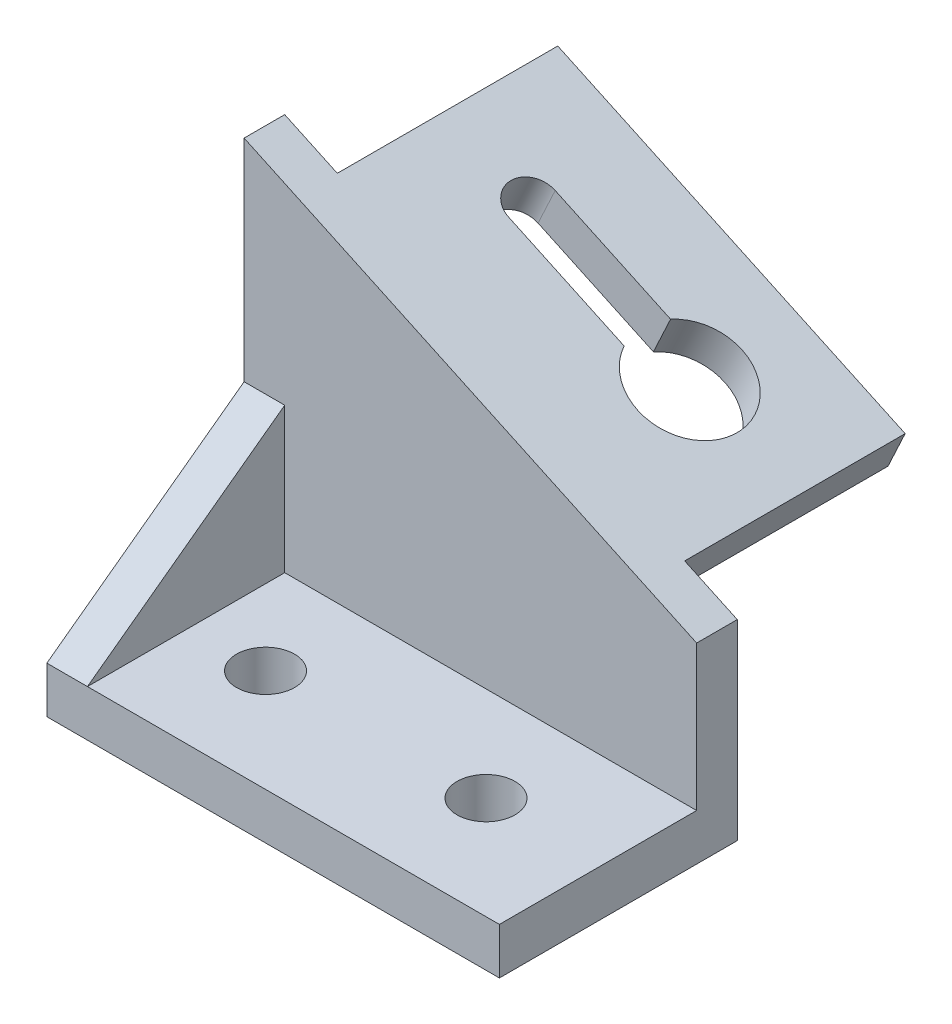
from build123d import *

# Parameters (mm, degrees)
SKETCH1_W           = 71
SKETCH1_H           = 34
SKETCH1_R           = 5
BOSS_EXTRUDE1_DEPTH = 8
SKETCH1_3_W         = 7
SKETCH1_3_H         = 34
BOSS_EXTRUDE2_DEPTH = 33
BOSS_EXTRUDE3_DEPTH = 80
CUT_EXTRUDE1_DEPTH  = 80
BOSS_EXTRUDE4_DEPTH = 7
CHAMFER1_SIZE2      = 34
CHAMFER1_SIZE       = 25


with BuildPart() as part:
    # Sketch1 → Boss-Extrude1 (new body)
    with BuildSketch(Plane(origin=(0, 0, 0), x_dir=(1, 0, 0), z_dir=(0, 1, 0))):
        with Locations((42.5, 17)):
            Rectangle(SKETCH1_W, SKETCH1_H)
        with Locations(Location((20, 17.695066584, 0), (0, 0, 270))):
            Circle(SKETCH1_R, mode=Mode.SUBTRACT)
        with Locations(Location((58, 17.695066584, 0), (0, 0, 270))):
            Circle(SKETCH1_R, mode=Mode.SUBTRACT)
    extrude(amount=BOSS_EXTRUDE1_DEPTH)

    # Sketch1<3> → Boss-Extrude2 (add)
    with BuildSketch(Plane(origin=(0, 0, 0), x_dir=(1, 0, 0), z_dir=(0, 1, 0))):
        with Locations((3.5, 17)):
            Rectangle(SKETCH1_3_W, SKETCH1_3_H)
    extrude(amount=BOSS_EXTRUDE2_DEPTH)

    # Sketch1<4> → Boss-Extrude3 (add)
    with BuildSketch(Plane(origin=(0, 0, 0), x_dir=(1, 0, 0), z_dir=(0, 1, 0))):
        Polygon((0, 41), (0, 34), (7, 34), (78, 34), (78, 41), align=None)
    extrude(amount=BOSS_EXTRUDE3_DEPTH)

    # Sketch2 → Cut-Extrude1 (cut)
    with BuildSketch(Plane.XY.offset(-34)):
        Polygon((0, 69.371997336), (78, 33), (78, 80), (0, 80), align=None)
    extrude(amount=-CUT_EXTRUDE1_DEPTH, mode=Mode.SUBTRACT)

    # Sketch3 → Boss-Extrude4 (add)
    with BuildSketch(Plane(origin=(26.571016534, 56.981728841, 0), x_dir=(0.9063077870366528, -0.42261826174069356, 0), z_dir=(0.42261826174069356, 0.9063077870366528, 0))):
        with BuildLine():
            Line((-19.317872928, 79), (-19.317872928, 60))
            Line((-19.317872928, 60), (-7.254395249, 60))
            ThreePointArc((-7.254395249, 60), (-6.082822373, 62.828427125), (-3.254395249, 64))
            Line((-3.254395249, 64), (18.683347003, 64))
            ThreePointArc((18.683347003, 64), (28.799829698, 68.762428879), (35.745604751, 60))
            Line((35.745604751, 60), (46.745604751, 60))
            Line((46.745604751, 60), (46.745604751, 79))
            Line((46.745604751, 79), (-19.317872928, 79))
        make_face()
        with BuildLine():
            Line((-19.317872928, 60), (-19.317872928, 41))
            Line((-19.317872928, 41), (46.745604751, 41))
            Line((46.745604751, 41), (46.745604751, 60))
            Line((46.745604751, 60), (35.745604751, 60))
            ThreePointArc((35.745604751, 60), (28.799829698, 51.237571121), (18.683347003, 56))
            Line((18.683347003, 56), (-3.254395249, 56))
            ThreePointArc((-3.254395249, 56), (-6.082822373, 57.171572875), (-7.254395249, 60))
            Line((-7.254395249, 60), (-19.317872928, 60))
        make_face()
    extrude(amount=-BOSS_EXTRUDE4_DEPTH)

    # Chamfer1
    chamfer1_edges = [part.edges().sort_by_distance(p)[0] for p in [
        (3.5, 33, 0),
    ]]
    chamfer1_side = [part.faces().sort_by_distance(p)[0] for p in [
        (3.5, 32.5, 0),
    ]]
    chamfer(chamfer1_edges, length=CHAMFER1_SIZE - 0.0001, length2=CHAMFER1_SIZE2 - 0.0001, reference=chamfer1_side[0])  # a hair under: the kernel refuses the full size


solid = part.part
